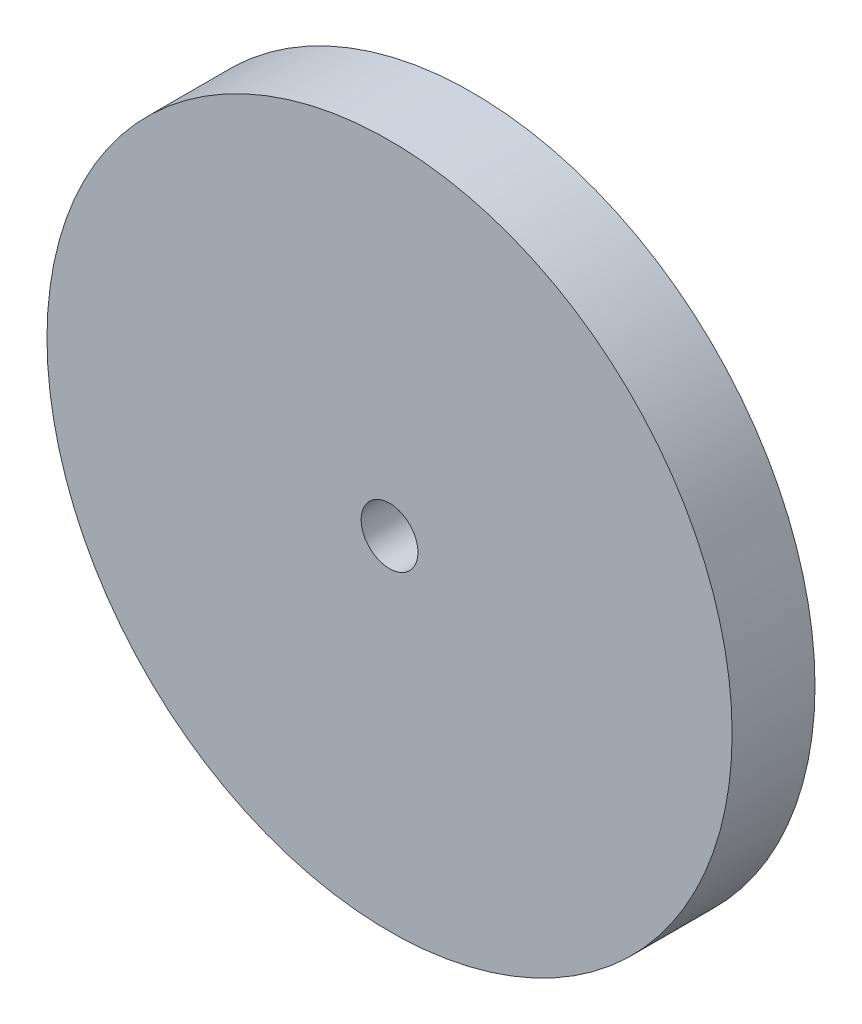
from build123d import *

# Parameters (mm, degrees)
SKETCH1_R           = 24.145
SKETCH1_R_2         = 2
BOSS_EXTRUDE1_DEPTH = 5.842


with BuildPart() as part:
    # Sketch1 → Boss-Extrude1 (new body)
    with BuildSketch(Plane.XY.offset(3.175)):
        with Locations((-35.533137827, 0)):
            Circle(SKETCH1_R)
        with Locations((-35.533137827, 0)):
            Circle(SKETCH1_R_2, mode=Mode.SUBTRACT)
    extrude(amount=BOSS_EXTRUDE1_DEPTH)


solid = part.part
